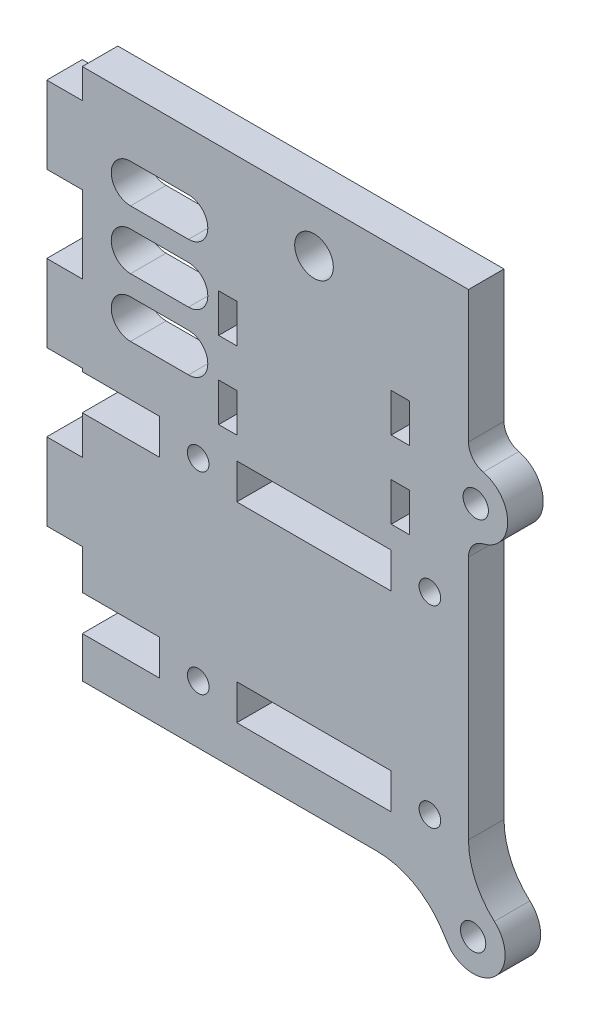
from build123d import *

# Parameters (mm, degrees)
SKETCH1_R           = 1.778
SKETCH1_W           = 25.4
SKETCH1_H           = 5.842
BOSS_EXTRUDE1_DEPTH = 5.842
SKETCH2_W           = 63.5
SKETCH2_H           = 6.757924
BOSS_EXTRUDE2_DEPTH = 5.842
FILLET1_R           = 3.175
SKETCH4_R           = 3.175
SKETCH4_W           = 2.975
SKETCH4_H           = 6.35
CUT_EXTRUDE2_DEPTH  = 95.65387769
CUT_EXTRUDE3_DEPTH  = 95.65387769
BOSS_EXTRUDE4_START = -5.842
SKETCH7_R           = 2.0828
BOSS_EXTRUDE4_DEPTH = 5.842
FILLET12_R          = 12.7
SKETCH8_R           = 2.0828
BOSS_EXTRUDE5_DEPTH = 5.842
FILLET13_R          = 3.175
SKETCH9_R           = 2.0828
CUT_EXTRUDE4_DEPTH  = 107.047047485


with BuildPart() as part:
    # Sketch1 → Boss-Extrude1 (new body)
    with BuildSketch(Plane.XY):
        Polygon((0, 12.7), (-5.842, 12.7), (-5.842, 0), (0, 0), (0, -12.7), (-5.842, -12.7), (-5.842, -25.4), (0, -25.4), (0, -25.908), (12.7, -25.908), (12.7, -31.75), (0, -31.75), (0, -38.1), (-5.842, -38.1), (-5.842, -50.8), (0, -50.8), (0, -57.349898), (12.7, -57.349898), (12.7, -63.191898), (25.4, -63.191898), (25.4, -57.349898), (50.8, -57.349898), (50.8, -63.191898), (63.5, -63.191898), (63.5, 17.55013), (0, 17.55013), align=None)
        with Locations((19.065986419, -60.397898)):
            Circle(SKETCH1_R, mode=Mode.SUBTRACT)
        with Locations((19.05, -28.702)):
            Circle(SKETCH1_R, mode=Mode.SUBTRACT)
        with Locations((57.157993209, -60.397898)):
            Circle(SKETCH1_R, mode=Mode.SUBTRACT)
        with Locations((38.1, -28.829)):
            Rectangle(SKETCH1_W, SKETCH1_H, mode=Mode.SUBTRACT)
        with Locations((57.15, -28.702)):
            Circle(SKETCH1_R, mode=Mode.SUBTRACT)
    extrude(amount=BOSS_EXTRUDE1_DEPTH)

    # Sketch2 → Boss-Extrude2 (add)
    with BuildSketch(Plane.XY.offset(5.842)):
        with Locations((31.75, -66.57086)):
            Rectangle(SKETCH2_W, SKETCH2_H)
    extrude(amount=-BOSS_EXTRUDE2_DEPTH)

    # Fillet1
    fillet1_edges = [part.edges().sort_by_distance(p)[0] for p in [
        (63.5, -69.949822, 2.921),
    ]]
    fillet(fillet1_edges, radius=FILLET1_R)

    # Sketch4 → Cut-Extrude2 (cut, through all)
    with BuildSketch(Plane.XY.offset(5.842)):
        with Locations((38.1, 9.61263)):
            Circle(SKETCH4_R)
        with Locations((23.9125, -6.35)):
            Rectangle(SKETCH4_W, SKETCH4_H)
        with Locations((23.9125, -19.05)):
            Rectangle(SKETCH4_W, SKETCH4_H)
        with Locations((52.2875, -19.05)):
            Rectangle(SKETCH4_W, SKETCH4_H)
        with Locations((52.2875, -6.35)):
            Rectangle(SKETCH4_W, SKETCH4_H)
    extrude(amount=-CUT_EXTRUDE2_DEPTH, mode=Mode.SUBTRACT)

    # Sketch5 → Cut-Extrude3 (cut, through all)
    with BuildSketch(Plane.XY.offset(5.842)):
        with BuildLine():
            Line((7.9375, 8.02513), (17.4625, 8.02513))
            ThreePointArc((17.4625, 8.02513), (20.6375, 4.85013), (17.4625, 1.67513))
            Line((17.4625, 1.67513), (7.9375, 1.67513))
            ThreePointArc((7.9375, 1.67513), (4.7625, 4.85013), (7.9375, 8.02513))
        make_face()
        with BuildLine():
            Line((7.9375, -1.62687), (17.4625, -1.62687))
            ThreePointArc((17.4625, -1.62687), (20.6375, -4.80187), (17.4625, -7.97687))
            Line((17.4625, -7.97687), (7.9375, -7.97687))
            ThreePointArc((7.9375, -7.97687), (4.7625, -4.80187), (7.9375, -1.62687))
        make_face()
        with BuildLine():
            Line((7.9375, -11.27887), (17.4625, -11.27887))
            ThreePointArc((17.4625, -11.27887), (20.6375, -14.45387), (17.4625, -17.62887))
            Line((17.4625, -17.62887), (7.9375, -17.62887))
            ThreePointArc((7.9375, -17.62887), (4.7625, -14.45387), (7.9375, -11.27887))
        make_face()
    extrude(amount=-CUT_EXTRUDE3_DEPTH, mode=Mode.SUBTRACT)

    # Sketch7 → Boss-Extrude4 (add)
    with BuildSketch(Plane.XY.offset(5.842).offset(BOSS_EXTRUDE4_START)):
        with BuildLine():
            Line((60.544173966, -77.950003252), (55.218486469, -69.949822))
            Line((55.218486469, -69.949822), (60.325, -69.949822))
            ThreePointArc((60.325, -69.949822), (62.57006403, -69.01988603), (63.5, -66.774822))
            Line((63.5, -66.774822), (67.615323654, -70.182525218))
            ThreePointArc((67.615323654, -70.182525218), (68.150012892, -77.771642798), (60.544173966, -77.950003252))
        make_face()
        with Locations((64.262, -74.232177218)):
            Circle(SKETCH7_R, mode=Mode.SUBTRACT)
    extrude(amount=BOSS_EXTRUDE4_DEPTH)

    # Fillet12
    fillet12_edges = [part.edges().sort_by_distance(p)[0] for p in [
        (55.218486469, -69.949822, 2.921),
        (63.5, -66.774822, 2.921),
    ]]
    fillet(fillet12_edges, radius=FILLET12_R)

    # Sketch8 → Boss-Extrude5 (add)
    with BuildSketch(Plane.XY.offset(5.842)):
        with BuildLine():
            Line((64.693546, -17.610328), (63.5, -17.610328))
            Line((63.5, -17.610328), (63.5, -17.473065939))
            ThreePointArc((63.5, -17.473065939), (59.435746, -12.352528), (63.5, -7.231990061))
            Line((63.5, -7.231990061), (63.5, -7.094728))
            Line((63.5, -7.094728), (64.693546, -7.094728))
            ThreePointArc((64.693546, -7.094728), (69.951346, -12.352528), (64.693546, -17.610328))
        make_face()
        with Locations((64.693546, -12.352528)):
            Circle(SKETCH8_R, mode=Mode.SUBTRACT)
    extrude(amount=-BOSS_EXTRUDE5_DEPTH)

    # Fillet13
    # the kernel refuses this fillet: 3.175 mm, written as the material it adds along each edge
    with BuildSketch(Plane(origin=(63.5, -7.094728, 5.842), x_dir=(0, 1, 0), z_dir=(0, 0, -1))) as fillet13_piece_1:
        with BuildLine():
            CenterArc((2.938903965, 3.175), FILLET13_R, 193.589847282, 76.410152718)
            Line((-0.147204456, 2.428970633), (-0.455815298, 2.354367696))
            ThreePointArc((-0.455815298, 2.354367696), (-0.3175, 1.193546), (-0.3175, 0))
            Line((-0.3175, 0), (0, -0.3175))
            Line((0, -0.3175), (2.938903965, -0.3175))
            Line((2.938903965, -0.3175), (2.938903965, 0))
        make_face()
    extrude(amount=5.842)
    with BuildSketch(Plane(origin=(63.5, -17.610328, 5.842), x_dir=(0.9981686426778995, 0.0604926505830248, 0), z_dir=(0, 0, -1))) as fillet13_piece_2:
        with BuildLine():
            CenterArc((2.99140335, 3.125585947), FILLET13_R, 183.468090933, 76.410152718)
            Line((-0.177782091, 2.933521781), (-0.494700635, 2.914315365))
            Line((-0.494700635, 2.914315365), (-0.316918544, -0.019206417))
            Line((-0.316918544, -0.019206417), (0.019206417, -0.316918544))
            ThreePointArc((0.019206417, -0.316918544), (1.210566607, -0.244717783), (2.377629483, -0.312558595))
            Line((2.377629483, -0.312558595), (2.433427107, 0))
        make_face()
    extrude(amount=5.842)
    # the kernel refuses this fillet: 3.175 mm, written as the material it takes off along each edge

    # Sketch9 → Cut-Extrude4 (cut, through all)
    with BuildSketch(Plane.XY.offset(5.842)):
        with Locations((64.693546, -12.352528)):
            Circle(SKETCH9_R)
    extrude(amount=-CUT_EXTRUDE4_DEPTH, mode=Mode.SUBTRACT)


solid = part.part
